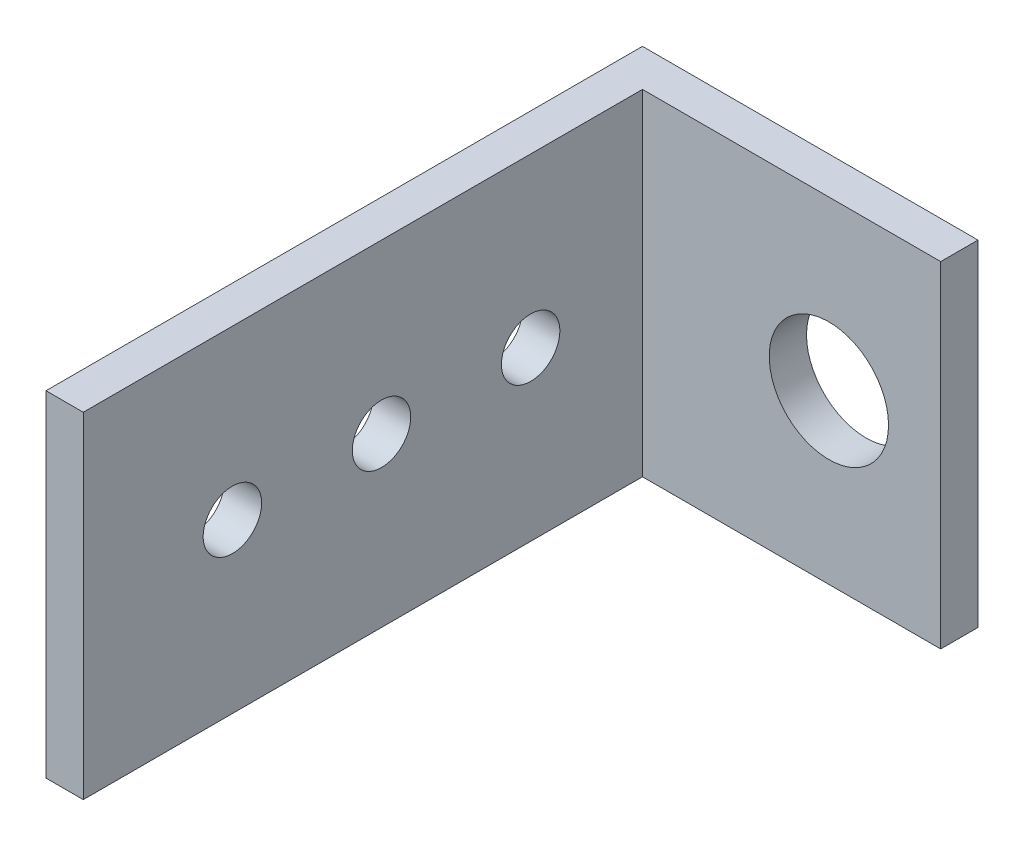
from build123d import *

# Parameters (mm, degrees)
BOSS_EXTRUDE1_DEPTH = 28.575
SKETCH2_R           = 5.08
CUT_EXTRUDE1_DEPTH  = 32.766
SKETCH3_R           = 2.4892
CUT_EXTRUDE2_DEPTH  = 32.766


with BuildPart() as part:
    # Sketch1 → Boss-Extrude1 (new body)
    with BuildSketch(Plane(origin=(0, 0, 0), x_dir=(1, 0, 0), z_dir=(0, 1, 0))):
        Polygon((0, 0), (3.175, 0), (3.175, 47.625), (28.575, 47.625), (28.575, 50.8), (0, 50.8), align=None)
    extrude(amount=BOSS_EXTRUDE1_DEPTH)

    # Sketch2 → Cut-Extrude1 (cut)
    with BuildSketch(Plane.XY.offset(-47.625)):
        with Locations((19.05, 14.2875)):
            Circle(SKETCH2_R)
    extrude(amount=-CUT_EXTRUDE1_DEPTH, mode=Mode.SUBTRACT)

    # Sketch3 → Cut-Extrude2 (cut)
    with BuildSketch(Plane(origin=(3.175, 0, 0), x_dir=(0, 0, -1), z_dir=(1, 0, 0))):
        with Locations((12.7, 14.2875)):
            Circle(SKETCH3_R)
        with Locations((25.4, 14.2875)):
            Circle(SKETCH3_R)
        with Locations((38.1, 14.2875)):
            Circle(SKETCH3_R)
    extrude(amount=-CUT_EXTRUDE2_DEPTH, mode=Mode.SUBTRACT)


solid = part.part
